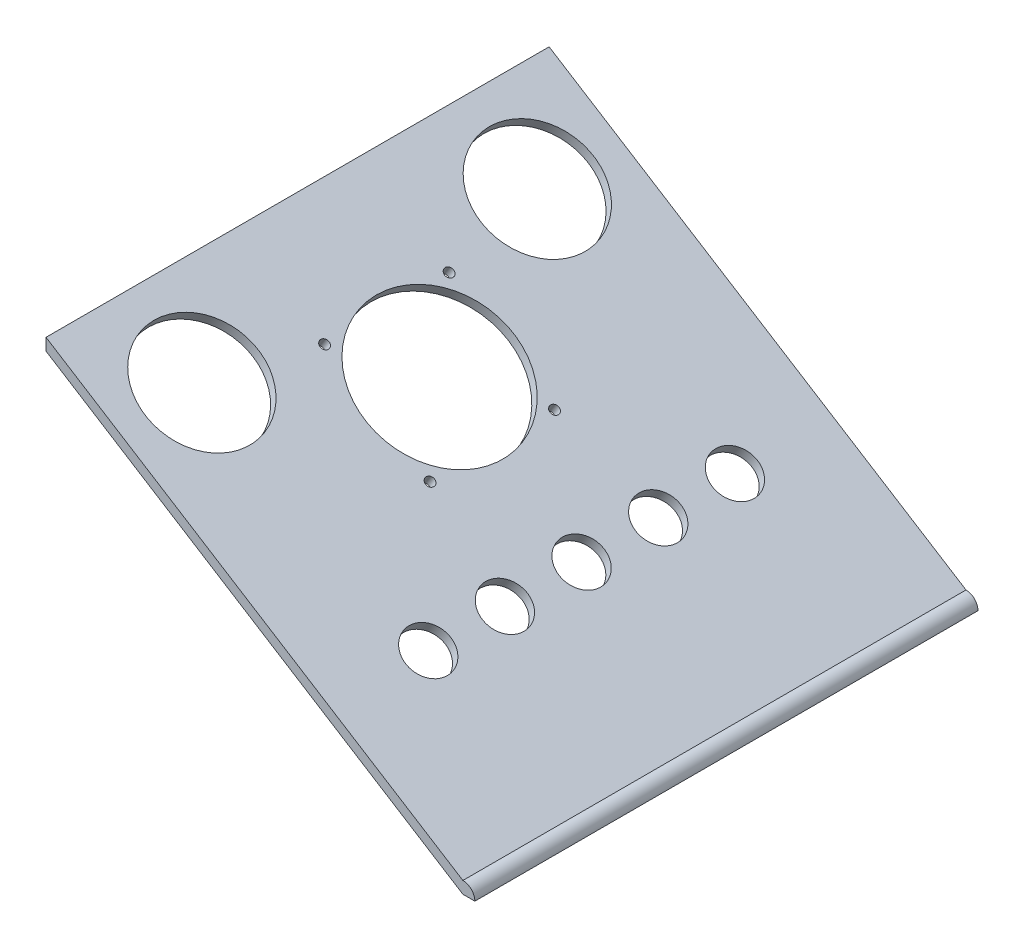
from build123d import *

# Parameters (mm, degrees)
BOSS_EXTRUDE1_DEPTH = 133.35
SKETCH2_R           = 1.2
SKETCH2_R_2         = 19.75
CUT_EXTRUDE1_DEPTH  = 187.593999065
SKETCH3_W           = 133.35
SKETCH3_H           = 3.175
BOSS_EXTRUDE2_DEPTH = 3.175
FILLET1_R           = 3.175
SKETCH5_R           = 15
CUT_EXTRUDE2_DEPTH  = 189.467318942
SKETCH6_R           = 6
SKETCH6_R_2         = 5.999988
CUT_EXTRUDE3_DEPTH  = 189.467318942


with BuildPart() as part:
    # Sketch1 → Boss-Extrude1 (new body)
    with BuildSketch(Plane.XY):
        Polygon((110.49, -69.425000088), (0, 0), (0, 3.175), (110.49, -66.250000088), align=None)
    extrude(amount=BOSS_EXTRUDE1_DEPTH)

    # Sketch2 → Cut-Extrude1 (cut, through all)
    with BuildSketch(Plane(origin=(1.430283892, 2.276299128, 0), x_dir=(0.8467258159330607, -0.5320295035357462, 0), z_dir=(0.5320295035357462, 0.8467258159330607, 0))):
        with Locations(Location((26.260806326, -83.175, 0), (0, 0, 180))):
            Circle(SKETCH2_R)
        with Locations(Location((42.760806326, -66.675, 0), (0, 0, 180))):
            Circle(SKETCH2_R_2)
        with Locations(Location((59.260806326, -83.175, 0), (0, 0, 180))):
            Circle(SKETCH2_R)
        with Locations(Location((26.260806326, -50.175, 0), (0, 0, 180))):
            Circle(SKETCH2_R)
        with Locations(Location((59.260806326, -50.175, 0), (0, 0, 180))):
            Circle(SKETCH2_R)
    extrude(amount=-CUT_EXTRUDE1_DEPTH, mode=Mode.SUBTRACT)

    # Sketch3 → Boss-Extrude2 (add)
    with BuildSketch(Plane(origin=(110.49, 0, 0), x_dir=(0, 0, -1), z_dir=(1, 0, 0))):
        with Locations((-66.675, -67.837500088)):
            Rectangle(SKETCH3_W, SKETCH3_H)
    extrude(amount=BOSS_EXTRUDE2_DEPTH)

    # Fillet1
    fillet1_edges = [part.edges().sort_by_distance(p)[0] for p in [
        (113.665, -66.250000088, 66.675),
    ]]
    fillet(fillet1_edges, radius=FILLET1_R - 0.0001)  # a hair under: the kernel refuses the full size

    # Sketch5 → Cut-Extrude2 (cut, through all)
    with BuildSketch(Plane(origin=(1.430283892, 2.276299128, 0), x_dir=(0.8467258159330606, -0.5320295035357464, 0), z_dir=(0.5320295035357464, 0.8467258159330606, 0))):
        with Locations(Location((20.851690059, -111.125, 0), (0, 0, 180))):
            Circle(SKETCH5_R)
        with Locations(Location((20.851690059, -22.225, 0), (0, 0, 180))):
            Circle(SKETCH5_R)
    extrude(amount=-CUT_EXTRUDE2_DEPTH, mode=Mode.SUBTRACT)

    # Sketch6 → Cut-Extrude3 (cut, through all)
    with BuildSketch(Plane(origin=(1.430283892, 2.276299128, 0), x_dir=(0.8467258159330606, -0.5320295035357464, 0), z_dir=(0.5320295035357464, 0.8467258159330606, 0))):
        with Locations(Location((87.210806326, -46.355, 0), (0, 0, 180))):
            Circle(SKETCH6_R)
        with Locations(Location((87.210806326, -26.035, 0), (0, 0, 180))):
            Circle(SKETCH6_R)
        with Locations(Location((87.210806326, -86.995, 0), (0, 0, 180))):
            Circle(SKETCH6_R)
        with Locations(Location((87.210806326, -107.315, 0), (0, 0, 180))):
            Circle(SKETCH6_R)
        with Locations(Location((87.210806326, -66.675, 0), (0, 0, 180))):
            Circle(SKETCH6_R_2)
    extrude(amount=-CUT_EXTRUDE3_DEPTH, mode=Mode.SUBTRACT)


solid = part.part
